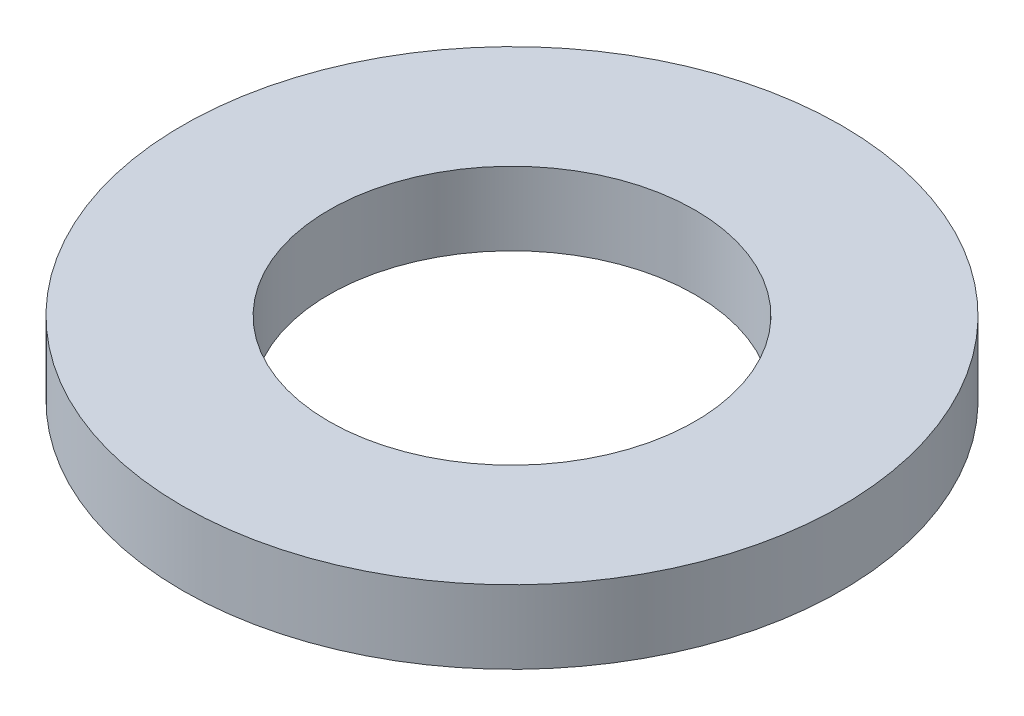
from build123d import *

# Parameters (mm, degrees)
SKETCH1_R           = 4.5
SKETCH1_R_2         = 2.5
BOSS_EXTRUDE1_DEPTH = 1


with BuildPart() as part:
    # Sketch1 → Boss-Extrude1 (new body)
    with BuildSketch(Plane(origin=(0, 0, 0), x_dir=(1, 0, 0), z_dir=(0, 1, 0))):
        Circle(SKETCH1_R)
        Circle(SKETCH1_R_2, mode=Mode.SUBTRACT)
    extrude(amount=BOSS_EXTRUDE1_DEPTH)


solid = part.part
